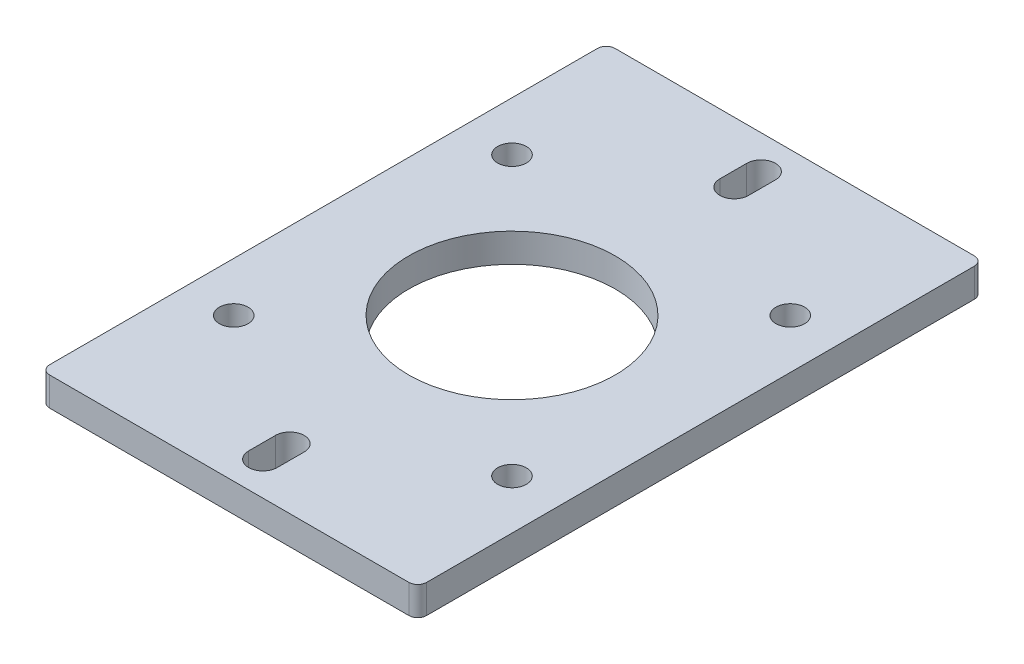
from build123d import *

# Parameters (mm, degrees)
SKETCH1_W                = 42
SKETCH1_H                = 63
SKETCH1_R                = 11.5
BOSS_EXTRUDE1_DEPTH      = 3.2
M3_CLEARANCE_HOLE1_D     = 3.2
M3_CLEARANCE_SLOT1_DEPTH = 3.2
FILLET1_R                = 1


# Read off the part's stored shape, not the designer's step: M3 Clearance Slot1
with BuildPart() as part:
    # Sketch1 → Boss-Extrude1 (new body)
    with BuildSketch(Plane(origin=(0, 0, 0), x_dir=(1, 0, 0), z_dir=(0, 1, 0))):
        Rectangle(SKETCH1_W, SKETCH1_H)
        with Locations(Location((0, 0, 0), (0, 0, 270))):
            Circle(SKETCH1_R, mode=Mode.SUBTRACT)
    extrude(amount=BOSS_EXTRUDE1_DEPTH)

    # M3 Clearance Hole1 (through all)
    with Locations(Plane(origin=(0, 3.2, 0), x_dir=(1, 0, 0), z_dir=(0, 1, 0))):
        with Locations((-15.5, 15.5), (15.5, 15.5), (15.5, -15.5), (-15.5, -15.5)):
            Hole(M3_CLEARANCE_HOLE1_D / 2)

    # M3 Clearance Slot1 outline → M3 Clearance Slot1 (cut)
    with BuildSketch(Plane(origin=(0, 0, 0), x_dir=(1, 0, 0), z_dir=(0, 1, 0))):
        with BuildLine():
            Line((1.6, -27.75), (1.6, -24.75))
            ThreePointArc((1.6, -24.75), (0, -23.15), (-1.6, -24.75))
            Line((-1.6, -24.75), (-1.6, -27.75))
            ThreePointArc((-1.6, -27.75), (0, -29.35), (1.6, -27.75))
        make_face()
        with BuildLine():
            ThreePointArc((1.6, 27.75), (0, 29.35), (-1.6, 27.75))
            Line((-1.6, 27.75), (-1.6, 24.75))
            ThreePointArc((-1.6, 24.75), (0, 23.15), (1.6, 24.75))
            Line((1.6, 24.75), (1.6, 27.75))
        make_face()
    extrude(amount=M3_CLEARANCE_SLOT1_DEPTH, mode=Mode.SUBTRACT)

    # Fillet1
    fillet1_edges = [part.edges().sort_by_distance(p)[0] for p in [
        (-21, 1.6, -31.5),
        (21, 1.6, -31.5),
        (21, 1.6, 31.5),
        (-21, 1.6, 31.5),
    ]]
    fillet(fillet1_edges, radius=FILLET1_R)


solid = part.part
